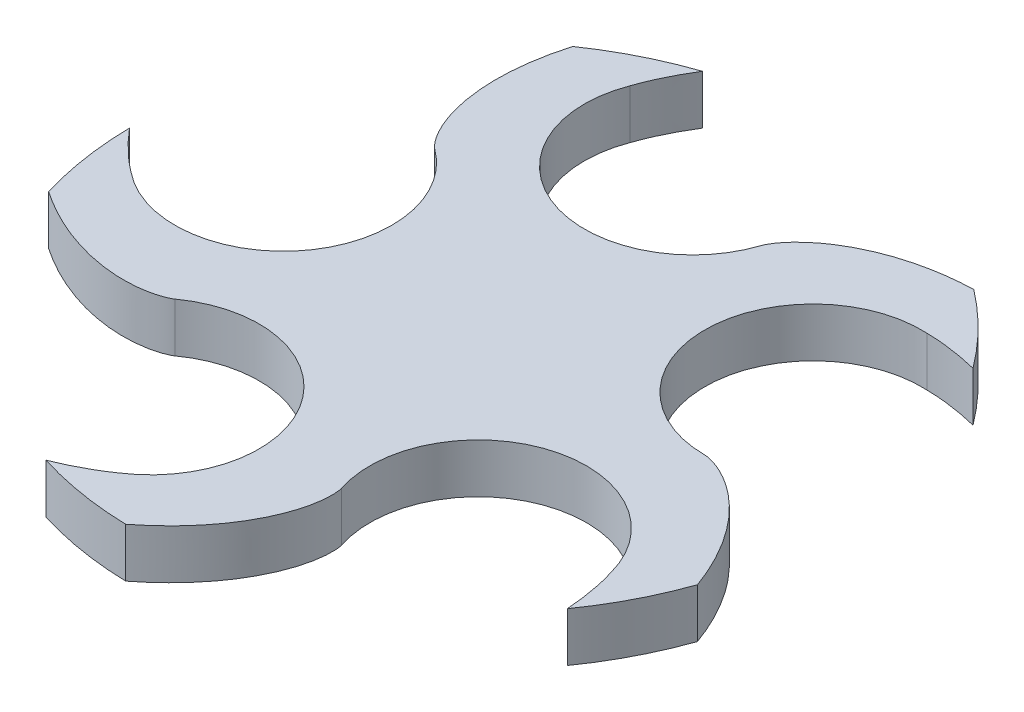
from build123d import *

# Parameters (mm, degrees)
SKETCH_1_R               = 71
EXTRUDE_1_DEPTH          = 5
SWEEP_START              = -5
SWEEP_1_DEPTH            = 10
SKETCH_3_W               = 22
SKETCH_3_H               = 10
PATTERN_CIRCULAR_1_COUNT = 5


# Read off the part's stored shape, not the designer's step: 切除-扫描1
with BuildPart() as part:
    # 草图1 → 凸台-拉伸1 (new, symmetric)
    with BuildSketch(Plane(origin=(0, 0, 0), x_dir=(1, 0, 0), z_dir=(0, 1, 0))):
        with Locations(Location((0, 0, 0), (0, 0, 270))):
            Circle(SKETCH_1_R)
    extrude(amount=EXTRUDE_1_DEPTH, both=True)

    # 切除-扫描1 outline → 切除-扫描1 (cut)
    with BuildSketch(Plane(origin=(0, 0, 0), x_dir=(1, 0, 0), z_dir=(0, 1, 0)).offset(SWEEP_START)):
        with BuildLine():
            Line((44.8999, 44), (44.8999, 0))
            add(Edge.make_bspline(
                [(44.8999, 0), (44.916561994, 0.000191347), (44.933259096, 0.000381998), (44.969446274, -0.000448692), (44.988908731, -0.001665871), (45.027841486, -0.00410628), (45.04726857, -0.005445338), (45.105435907, -0.010090978), (45.144104987, -0.01379923), (45.259805119, -0.026283625), (45.33654128, -0.03637541), (45.565945621, -0.070552579), (45.717932624, -0.098483603), (46.020333363, -0.161720525), (46.171094363, -0.197235401), (46.396888378, -0.255141946), (46.472031185, -0.275270724), (46.621872304, -0.316984405), (46.69663955, -0.338508995), (46.920092847, -0.405215815), (47.069540287, -0.452627037), (47.366049366, -0.552214559), (47.514123864, -0.604520722), (47.809119565, -0.713797573), (47.95617674, -0.770691592), (48.175586743, -0.859230018), (48.248622999, -0.889259555), (48.357750438, -0.934974229), (48.394110156, -0.950310128), (48.466649517, -0.981312724), (48.50251174, -0.996745919), (48.575497426, -1.028478937), (48.612552106, -1.044714784), (48.685855112, -1.077042599), (48.72243235, -1.093374379), (48.831899215, -1.142674788), (48.904640163, -1.175956007), (49.049463149, -1.24321203), (49.121491172, -1.277323431), (49.229061727, -1.328840559), (49.264815693, -1.346119986), (49.336111631, -1.380871104), (49.37169776, -1.398279431), (49.478249648, -1.451020625), (49.549127498, -1.486486891), (49.690429618, -1.558297415), (49.760823693, -1.594699072), (49.971666477, -1.704535079), (50.11121904, -1.779672727), (50.388028463, -1.931843655), (50.525106993, -2.009219245), (50.797819472, -2.16648661), (50.933339813, -2.24659507), (51.202877906, -2.409310011), (51.336931807, -2.491895295), (51.5033746, -2.59691805), (51.536635541, -2.617968989), (51.60305195, -2.660246506), (51.636193587, -2.681482176), (51.702418803, -2.724062169), (51.735506295, -2.745388547), (51.801529555, -2.788279138), (51.83448472, -2.809817106), (51.900031902, -2.852816994), (51.932632998, -2.874280696), (51.981438761, -2.90661199), (51.997683073, -2.917426998), (52.030190412, -2.939032245), (52.046433322, -2.949844151), (52.078838589, -2.971598736), (52.095058922, -2.982456937), (52.127474374, -3.004194102), (52.143632925, -3.01513569), (52.192142382, -3.047921881), (52.224480641, -3.069776937), (52.385754428, -3.179676238), (52.513960597, -3.268801627), (52.768949774, -3.449033479), (52.895695422, -3.540211535), (53.147512638, -3.724795094), (53.272658894, -3.818100974), (53.460287362, -3.960131365), (53.52323327, -4.008272903), (53.648722432, -4.105061503), (53.711286088, -4.153683755), (53.836083407, -4.251336901), (53.898254999, -4.300448776), (54.022164217, -4.399207025), (54.083912882, -4.44883848), (54.268777657, -4.598195997), (54.391045114, -4.698957412), (54.543098971, -4.825834507), (54.573406839, -4.851332597), (54.618923659, -4.889513481), (54.634052767, -4.902290051), (54.664278153, -4.9278862), (54.679442376, -4.940623418), (54.724736542, -4.979065015), (54.754890875, -5.004746387), (54.815109151, -5.056206991), (54.845200209, -5.081961863), (54.905004448, -5.133509762), (54.934771216, -5.159245039), (54.994256886, -5.210768228), (55.023888349, -5.236657655), (55.083179792, -5.288408226), (55.112781108, -5.314330282), (55.171833606, -5.366354219), (55.201310238, -5.392421962), (55.260222992, -5.444602796), (55.289591507, -5.470796804), (55.333666463, -5.51005387), (55.348278652, -5.523225195), (55.377587468, -5.54949182), (55.392262354, -5.562591307), (55.421466865, -5.588965017), (55.43612197, -5.602101482), (55.465334146, -5.62845874), (55.479874125, -5.641720818), (55.509084908, -5.66809153), (55.52362817, -5.681335336), (55.552714608, -5.707848674), (55.567310103, -5.721045115), (55.610929361, -5.760811955), (55.639944692, -5.787400551), (55.697867093, -5.840687942), (55.726788198, -5.867377848), (55.813453747, -5.947558979), (55.871007332, -6.001244533), (55.942715648, -6.068621357), (55.957076348, -6.082080519), (55.985757753, -6.109026642), (56.000010315, -6.122590693), (56.042920701, -6.16315426), (56.071490022, -6.1902122), (56.128485312, -6.244513001), (56.157007381, -6.271637737), (56.213794816, -6.326148138), (56.242162485, -6.353442863), (56.298671659, -6.407917253), (56.326709837, -6.435213939), (56.368832998, -6.476100375), (56.382869349, -6.489727999), (56.410870169, -6.517065387), (56.424883889, -6.530726173), (56.494827856, -6.599119938), (56.55062998, -6.654023151), (56.633967279, -6.736717431), (56.661706213, -6.764335918), (56.71714206, -6.819594086), (56.744727664, -6.847356775), (56.799960093, -6.90283554), (56.827526048, -6.930621805), (56.882569862, -6.986275886), (56.910033465, -7.014173717), (56.96493682, -7.069972508), (56.99225245, -7.098006339), (57.033272391, -7.14002298), (57.046950213, -7.154019348), (57.074224499, -7.182095728), (57.087868812, -7.196133807), (57.115123384, -7.224227777), (57.12871507, -7.238313767), (57.155930817, -7.266451991), (57.169500746, -7.280550962), (57.196642364, -7.308766844), (57.210228898, -7.32285132), (57.237292181, -7.351136269), (57.250877279, -7.365241872), (57.291527367, -7.40760017), (57.318481722, -7.43600565), (57.372430503, -7.492742058), (57.399347675, -7.521169802), (57.45307395, -7.578136116), (57.479942087, -7.606605358), (57.520143989, -7.649424035), (57.533547562, -7.663686596), (57.560272754, -7.692297979), (57.573654904, -7.70659108), (57.600281436, -7.735160615), (57.613538273, -7.749444187), (57.640082845, -7.777969338), (57.653287751, -7.792288996), (57.679803561, -7.820858055), (57.693079645, -7.835106852), (57.719465067, -7.863778494), (57.73266659, -7.878113874), (57.759060077, -7.906782014), (57.772268772, -7.921111922), (57.798659111, -7.949777643), (57.811750597, -7.964202006), (57.838062553, -7.992960162), (57.851237439, -8.007307398), (57.877483068, -8.036113156), (57.890624413, -8.050501916), (57.929935573, -8.093757497), (57.956096434, -8.122641882), (58.008327958, -8.180498515), (58.03447753, -8.209389407), (58.073456162, -8.252952245), (58.086468116, -8.267464726), (58.112508301, -8.296457783), (58.125489824, -8.310986208), (58.1643678, -8.354640205), (58.190306585, -8.383729817), (58.267833522, -8.47124281), (58.319355499, -8.5297374), (58.396453771, -8.61763532), (58.422046776, -8.647028534), (58.460467922, -8.691089601), (58.473262278, -8.705786064), (58.498755138, -8.735262087), (58.511497752, -8.750012089), (58.549824224, -8.794157107), (58.575206069, -8.823727238), (58.626030617, -8.882831002), (58.65137744, -8.912432615), (58.702055439, -8.97166088), (58.72735243, -9.001309536), (58.765202909, -9.045857089), (58.777782799, -9.060741358), (58.802981404, -9.090472319), (58.815516075, -9.105387132), (58.840891172, -9.135397978), (58.853700082, -9.150499952), (58.879142266, -9.180865527), (58.891934453, -9.195993137), (58.930168796, -9.241474713), (58.955494057, -9.271940141), (59.031675506, -9.363152892), (59.082140369, -9.424228963), (59.145194143, -9.500590382), (59.157780723, -9.515881055), (59.182861469, -9.54654024), (59.195426456, -9.56185403), (59.23315314, -9.607754399), (59.258102993, -9.638519321), (59.308131148, -9.699945899), (59.333035188, -9.730745247), (59.370446485, -9.776900915), (59.382893564, -9.792302964), (59.407731144, -9.823155658), (59.420160992, -9.838573673), (59.457447395, -9.884826202), (59.482220304, -9.915727903), (59.531613271, -9.977652121), (59.556260156, -10.00865379), (59.593300356, -10.055096719), (59.605620056, -10.070598305), (59.630121453, -10.101710732), (59.642375147, -10.117265774), (59.666957967, -10.148313611), (59.679234267, -10.163847731), (59.703654619, -10.195021599), (59.715921411, -10.210564656), (59.752606853, -10.257279206), (59.7769867, -10.288482188), (59.825725831, -10.350900371), (59.850092005, -10.382110322), (59.898544858, -10.444744049), (59.922755415, -10.476071537), (59.959000347, -10.523115109), (59.971081089, -10.538796552), (59.995266666, -10.570140179), (60.007263293, -10.585885987), (60.031302961, -10.617269957), (60.043332758, -10.6329198), (60.067219281, -10.664349527), (60.079250421, -10.679996979), (60.103155478, -10.711411932), (60.115099613, -10.727124634), (60.138998265, -10.758542993), (60.150893894, -10.77429231), (60.174741782, -10.805747459), (60.186625831, -10.821505382), (60.210384091, -10.853026768), (60.222281799, -10.868772996), (60.246047115, -10.900288394), (60.257881998, -10.916081907), (60.281572586, -10.947651639), (60.293459316, -10.963404479), (60.317110908, -10.995004908), (60.328861893, -11.010858151), (60.352511137, -11.042457064), (60.36423183, -11.058335019), (60.38777312, -11.090011804), (60.399564622, -11.105836038), (60.42305835, -11.137548267), (60.434819482, -11.153393307), (60.493555029, -11.232671167), (60.540169995, -11.296366321), (60.610074902, -11.391911935), (60.63325854, -11.423848552), (60.668076095, -11.471715578), (60.679703662, -11.487657055), (60.702830815, -11.519631777), (60.71435481, -11.535645537), (60.737526796, -11.567585257), (60.749032819, -11.58361624), (60.772070777, -11.615649714), (60.783642332, -11.631630627), (60.806658252, -11.663683402), (60.81812571, -11.679738548), (60.841063488, -11.711844586), (60.852591642, -11.727852767), (60.87556522, -11.759937269), (60.886968597, -11.776035621), (60.909863053, -11.808172803), (60.92122386, -11.824303279), (60.944109204, -11.856442415), (60.955534539, -11.872530959), (60.978244962, -11.904795388), (60.98964623, -11.92089508), (61.012382476, -11.953142411), (61.02373638, -11.969275232), (61.046496804, -12.001503399), (61.057840901, -12.017647839), (61.080437058, -12.049990393), (61.091808651, -12.066111055), (61.114392375, -12.09846503), (61.125717239, -12.114615191), (61.148253342, -12.146942608), (61.159458879, -12.16311287), (61.18194466, -12.195408826), (61.193112076, -12.211609184), (61.215564895, -12.243924241), (61.226805447, -12.260074491), (61.249169792, -12.292455187), (61.260323087, -12.308662404), (61.282660487, -12.341060273), (61.293753929, -12.357311459), (61.316059703, -12.389726231), (61.327277221, -12.405889708), (61.349528169, -12.438352641), (61.360533434, -12.454660687), (61.382722673, -12.487156393), (61.393811279, -12.503409972), (61.416002872, -12.535904738), (61.42708239, -12.552166187), (61.449172273, -12.584730955), (61.46023015, -12.601002122), (61.482354338, -12.633545347), (61.493315635, -12.649888217), (61.515321485, -12.682505104), (61.526355651, -12.69879724), (61.559300109, -12.747773709), (61.581304998, -12.780393757), (61.614074819, -12.829491181), (61.624977044, -12.84586579), (61.646865564, -12.87856551), (61.65778817, -12.894934865), (61.679509667, -12.927745341), (61.690504574, -12.944052027), (61.712287326, -12.976838684), (61.72306549, -12.993290075), (61.755722054, -13.042459267), (61.777297132, -13.075373623), (61.809812238, -13.124626607), (61.820650626, -13.141056851), (61.842145217, -13.174015288), (61.852985937, -13.190431167), (61.874526135, -13.223366833), (61.885230303, -13.2398764), (61.906726456, -13.272830991), (61.917505277, -13.289294915), (61.938932288, -13.322301036), (61.949648234, -13.338798818), (61.971114692, -13.371779352), (61.981771181, -13.388326149), (62.003080708, -13.421402352), (62.013804087, -13.437895556), (62.035163167, -13.470952212), (62.045704101, -13.487564483), (62.067082623, -13.520595406), (62.077712166, -13.537165885), (62.098902197, -13.570317944), (62.109549295, -13.586865332), (62.14134543, -13.636600561), (62.162501452, -13.669779043), (62.204648234, -13.736141736), (62.225687091, -13.76928539), (62.25710438, -13.819094307), (62.267600253, -13.83567879), (62.288501626, -13.868919314), (62.298918896, -13.88554983), (62.330309755, -13.935377112), (62.351152782, -13.968653235), (62.392699964, -14.035276412), (62.413484346, -14.068589824), (62.454891428, -14.135301958), (62.475558498, -14.168687284), (62.506502387, -14.218794852), (62.516813127, -14.235496323), (62.537460024, -14.268894412), (62.547684921, -14.285660827), (62.578454189, -14.335865343), (62.599048621, -14.369307841), (62.629655626, -14.419621818), (62.639913849, -14.436355851), (62.66033385, -14.469899307), (62.670484344, -14.486705371), (62.690822276, -14.520287115), (62.701036752, -14.537047415), (62.721430085, -14.570607741), (62.73151317, -14.587457943), (62.761953208, -14.637868175), (62.78221759, -14.671517529), (62.842699189, -14.772593066), (62.88310454, -14.839945961), (62.943109649, -14.941326787), (62.963083683, -14.97512716), (62.993089551, -15.02582247), (63.003037549, -15.042760741), (63.022859959, -15.076658463), (63.032825956, -15.093565743), (63.052756865, -15.12740734), (63.062629722, -15.144396476), (63.082389311, -15.178317605), (63.092353919, -15.195244401), (63.112091824, -15.22919897), (63.121962762, -15.246167168), (63.141731065, -15.280102061), (63.151574529, -15.29710011), (63.171203621, -15.331062086), (63.181037238, -15.348003084), (63.200655162, -15.38193652), (63.21036167, -15.398945687), (63.2300594, -15.432814426), (63.239834067, -15.449821098), (63.259260916, -15.483851611), (63.26902211, -15.500826109), (63.288561729, -15.534805615), (63.298258229, -15.551829643), (63.3177243, -15.585844226), (63.327396226, -15.602892445), (63.346761566, -15.636958214), (63.356442869, -15.65399655), (63.375822273, -15.688052299), (63.385501503, -15.70510772), (63.39995263, -15.730692317), (63.404797086, -15.739197102), (63.414500997, -15.756225209), (63.419333007, -15.764766118), (63.433685384, -15.79043038), (63.443319014, -15.807461483), (63.472212162, -15.858691232), (63.491375863, -15.892857111), (63.520105026, -15.944156499), (63.529639598, -15.961274437), (63.548781718, -15.995472926), (63.558263937, -16.012651585), (63.577264972, -16.046898172), (63.586879323, -16.063992106), (63.601132271, -16.089700366), (63.60589234, -16.098258301), (63.615416602, -16.115390457), (63.620162141, -16.12397632), (63.634313383, -16.149748431), (63.643840353, -16.166843663), (63.662821882, -16.201166696), (63.672192465, -16.218382646), (63.691060743, -16.252718537), (63.700583183, -16.269863298), (63.719368247, -16.304272816), (63.728783148, -16.321444524), (63.74766662, -16.355797533), (63.757026191, -16.373041389), (63.775742211, -16.407461754), (63.785142564, -16.424675996), (63.799170439, -16.450504471), (63.803864157, -16.459099039), (63.813255487, -16.476306727), (63.817936065, -16.484929097), (63.831899362, -16.510810061), (63.841235361, -16.528026091), (63.869224479, -16.57975449), (63.887810973, -16.614239893), (63.915696503, -16.666044799), (63.924838699, -16.683376928), (63.943436156, -16.7178687), (63.952663239, -16.73519895), (63.971138113, -16.76974523), (63.980375626, -16.787078652), (63.994138239, -16.813036584), (63.998768279, -16.821660327), (64.008031332, -16.838942606), (64.012637658, -16.847611174), (64.021804411, -16.864939985), (64.026390723, -16.873587983), (64.035607845, -16.890886823), (64.040216065, -16.899553203), (64.053915931, -16.925587449), (64.063109591, -16.942862521), (64.081474544, -16.97750755), (64.090533646, -16.994828641), (64.10877874, -17.029456647), (64.117874384, -17.046795829), (64.145081027, -17.098815891), (64.163286002, -17.133457806), (64.199573244, -17.202831498), (64.217705082, -17.237515079), (64.253648932, -17.307097959), (64.271682064, -17.341799469), (64.298578339, -17.394025136), (64.3074878, -17.41143556), (64.325421992, -17.446231861), (64.334346148, -17.463655767), (64.361167362, -17.515885917), (64.37892513, -17.550800175), (64.405629275, -17.603063727), (64.414580475, -17.620493853), (64.432254415, -17.655433511), (64.441085488, -17.672886991), (64.458825424, -17.707777647), (64.467710786, -17.725227811), (64.485333788, -17.760204947), (64.494128853, -17.777668524), (64.520604854, -17.830102663), (64.53818874, -17.865078217), (64.564460045, -17.917606235), (64.573184145, -17.93512589), (64.590741369, -17.970100135), (64.599514379, -17.98763474), (64.616895476, -18.022715607), (64.625615243, -18.04021419), (64.638722324, -18.066508257), (64.643067034, -18.075297461), (64.651716711, -18.09286017), (64.656041872, -18.10162453), (64.677809424, -18.145431194), (64.695182891, -18.180576793), (64.7210048, -18.233309923), (64.729672218, -18.250829572), (64.747007371, -18.285977449), (64.755478932, -18.303617843), (64.772770492, -18.338726778), (64.781354516, -18.356367083), (64.798462028, -18.391572611), (64.80705493, -18.409154674), (64.824236076, -18.444344714), (64.832787479, -18.461981453), (64.849813393, -18.497230662), (64.858384009, -18.514832722), (64.883938577, -18.567725956), (64.900969555, -18.602988906), (64.951718319, -18.708833399), (64.985562067, -18.779345877), (65.027445556, -18.867718526), (65.035788339, -18.885409692), (65.052533231, -18.920729346), (65.060962239, -18.938403234), (65.077581763, -18.973822056), (65.085880576, -18.991507327), (65.102571881, -19.026875457), (65.110866531, -19.04459602), (65.127551089, -19.079946297), (65.135870439, -19.097698229), (65.152392293, -19.133121185), (65.160725651, -19.150813599), (65.177255804, -19.186289798), (65.185438139, -19.20404174), (65.201936319, -19.239501109), (65.210139702, -19.257264799), (65.234859842, -19.310447592), (65.251292627, -19.345997928), (65.283981025, -19.417034244), (65.300405663, -19.45256646), (65.332887681, -19.52373761), (65.349221331, -19.559270924), (65.373480593, -19.612720276), (65.381541887, -19.630520479), (65.397745421, -19.666125566), (65.405821308, -19.683960586), (65.429947683, -19.73743583), (65.44617327, -19.772991897), (65.470214377, -19.826598711), (65.478133976, -19.844462721), (65.494163958, -19.880110526), (65.502219035, -19.897993686), (65.514119614, -19.924791827), (65.518109307, -19.933692391), (65.52612462, -19.951539797), (65.530118424, -19.960499318), (65.541990891, -19.987337602), (65.550001086, -20.00512368), (65.565974771, -20.040877153), (65.573805714, -20.05884051), (65.589607909, -20.094546392), (65.597617762, -20.112434028), (65.613381833, -20.14825331), (65.621248864, -20.166127834), (65.637064297, -20.201930939), (65.64485117, -20.219861473), (65.656716869, -20.246685807), (65.660677992, -20.255654106), (65.668512569, -20.27359679), (65.672405477, -20.282554078), (65.684176255, -20.309405106), (65.691987022, -20.327406178), (65.707608872, -20.363184417), (65.715486562, -20.381143469), (65.727125331, -20.408038366), (65.731028173, -20.416984636), (65.738831447, -20.434923905), (65.742708689, -20.443918438), (65.754306102, -20.470841295), (65.762149941, -20.488731207), (65.777657122, -20.524657448), (65.785350941, -20.542622759), (65.808554006, -20.596462759), (65.82401724, -20.632401822), (65.8471039, -20.686318883), (65.854798552, -20.704273507), (65.870198847, -20.740240724), (65.87778082, -20.758248959), (65.893182119, -20.794171151), (65.900842716, -20.812214725), (65.916005489, -20.84825673), (65.923648549, -20.866202497), (65.938914019, -20.902253647), (65.946463089, -20.920270794), (65.961653461, -20.956296357), (65.969240096, -20.974325192), (65.984417487, -21.010338107), (65.992085058, -21.028338602), (66.007170086, -21.064441818), (66.014688721, -21.082463005), (66.029789945, -21.118532888), (66.037301839, -21.1366114), (66.052249702, -21.172738482), (66.059765022, -21.190743928), (66.074853843, -21.226841194), (66.082303899, -21.244968111), (66.097162507, -21.281087042), (66.104754912, -21.299112231), (66.119624346, -21.33530556), (66.127039545, -21.353361222), (66.141945465, -21.389519118), (66.149277722, -21.407672511), (66.164144653, -21.443762104), (66.171622752, -21.461901022), (66.186356451, -21.498100017), (66.193763399, -21.516186638), (66.215912255, -21.570514468), (66.230503237, -21.606787769), (66.252568302, -21.661114211), (66.259931719, -21.67924386), (66.274533389, -21.715526421), (66.281867333, -21.733610339), (66.303831242, -21.788055241), (66.318314876, -21.824335868), (66.347289648, -21.897002489), (66.361701125, -21.933317852), (66.383484094, -21.987762219), (66.390655672, -22.005994883), (66.405021278, -22.042324705), (66.41224798, -22.060488976), (66.426552937, -22.096913359), (66.43370951, -22.115052542), (66.448108793, -22.151462096), (66.455166528, -22.169690482), (66.469465559, -22.206061187), (66.476654399, -22.224294743), (66.4907655, -22.260753585), (66.497958691, -22.278896834), (66.512162983, -22.315364946), (66.519238749, -22.333564478), (66.533411082, -22.370020255), (66.540453628, -22.388271761), (66.561554977, -22.442980764), (66.575667221, -22.479470827), (66.596705953, -22.534189991), (66.603785155, -22.552422852), (66.617751529, -22.58896072), (66.624719444, -22.607200372), (66.638716394, -22.643716456), (66.645604581, -22.66203646), (66.659544235, -22.698512808), (66.666534326, -22.716822832), (66.680367786, -22.753375469), (66.687332224, -22.771623595), (66.7011696, -22.808237904), (66.708003776, -22.826503036), (66.728829047, -22.881351867), (66.74255065, -22.917973148), (66.763058943, -22.97291522), (66.769970311, -22.991177787), (66.783642379, -23.027840365), (66.790483729, -23.046120417), (66.80405512, -23.082840076), (66.81083606, -23.101083902), (66.824520252, -23.137768532), (66.831218121, -23.156125548), (66.851540487, -23.211099881), (66.865151991, -23.247757682), (66.892095467, -23.321176892), (66.905573723, -23.357816778), (66.925633554, -23.412986717), (66.932235235, -23.431358839), (66.94565308, -23.468029179), (66.952361578, -23.48645524), (66.965267838, -23.522336064), (66.971645411, -23.539801109), (66.978007861, -23.557301692)],
                knots=[0, 0, 0, 0, 0.001342085, 0.001342085, 0.002918488, 0.002918488, 0.004494891, 0.004494891, 0.007647696, 0.007647696, 0.013953308, 0.013953308, 0.02656453, 0.02656453, 0.039175752, 0.039175752, 0.045481363, 0.045481363, 0.051786974, 0.051786974, 0.064328355, 0.064328355, 0.076869736, 0.076869736, 0.089411117, 0.089411117, 0.095681807, 0.095681807, 0.098817152, 0.098817152, 0.101952498, 0.101952498, 0.105140621, 0.105140621, 0.108328744, 0.108328744, 0.114704991, 0.114704991, 0.121081237, 0.121081237, 0.12426936, 0.12426936, 0.127457484, 0.127457484, 0.13383373, 0.13383373, 0.140209977, 0.140209977, 0.15296247, 0.15296247, 0.165627501, 0.165627501, 0.178292533, 0.178292533, 0.190957565, 0.190957565, 0.194123823, 0.194123823, 0.197290081, 0.197290081, 0.200456339, 0.200456339, 0.203622596, 0.203622596, 0.206761595, 0.206761595, 0.208331094, 0.208331094, 0.209900594, 0.209900594, 0.211470093, 0.211470093, 0.213039592, 0.213039592, 0.216178591, 0.216178591, 0.228734585, 0.228734585, 0.24129058, 0.24129058, 0.253846574, 0.253846574, 0.260222122, 0.260222122, 0.266597669, 0.266597669, 0.272973216, 0.272973216, 0.279348764, 0.279348764, 0.292099858, 0.292099858, 0.295287632, 0.295287632, 0.296881519, 0.296881519, 0.298475406, 0.298475406, 0.301663179, 0.301663179, 0.304850953, 0.304850953, 0.30801797, 0.30801797, 0.311184986, 0.311184986, 0.314352003, 0.314352003, 0.317519019, 0.317519019, 0.320686036, 0.320686036, 0.322269544, 0.322269544, 0.323853053, 0.323853053, 0.325436561, 0.325436561, 0.327020069, 0.327020069, 0.328603577, 0.328603577, 0.330187086, 0.330187086, 0.333354102, 0.333354102, 0.336521119, 0.336521119, 0.342855152, 0.342855152, 0.34443866, 0.34443866, 0.346022169, 0.346022169, 0.349189185, 0.349189185, 0.352356202, 0.352356202, 0.355523218, 0.355523218, 0.358671699, 0.358671699, 0.360245939, 0.360245939, 0.361820179, 0.361820179, 0.36811714, 0.36811714, 0.37126562, 0.37126562, 0.374414101, 0.374414101, 0.377562581, 0.377562581, 0.380711062, 0.380711062, 0.383859542, 0.383859542, 0.385433782, 0.385433782, 0.387008022, 0.387008022, 0.388582263, 0.388582263, 0.390156503, 0.390156503, 0.391730743, 0.391730743, 0.393304983, 0.393304983, 0.396453464, 0.396453464, 0.399601944, 0.399601944, 0.402750424, 0.402750424, 0.404324665, 0.404324665, 0.405898905, 0.405898905, 0.407465635, 0.407465635, 0.409032366, 0.409032366, 0.410599097, 0.410599097, 0.412165827, 0.412165827, 0.413732558, 0.413732558, 0.415299289, 0.415299289, 0.41686602, 0.41686602, 0.41843275, 0.41843275, 0.421566212, 0.421566212, 0.424699673, 0.424699673, 0.426266404, 0.426266404, 0.427833134, 0.427833134, 0.430966596, 0.430966596, 0.437233518, 0.437233518, 0.44036698, 0.44036698, 0.44193371, 0.44193371, 0.443500441, 0.443500441, 0.446633902, 0.446633902, 0.449767364, 0.449767364, 0.452900825, 0.452900825, 0.454467556, 0.454467556, 0.456034286, 0.456034286, 0.45762682, 0.45762682, 0.459219353, 0.459219353, 0.462404421, 0.462404421, 0.468774555, 0.468774555, 0.470367088, 0.470367088, 0.471959622, 0.471959622, 0.475144689, 0.475144689, 0.478329756, 0.478329756, 0.479922289, 0.479922289, 0.481514823, 0.481514823, 0.48469989, 0.48469989, 0.487884957, 0.487884957, 0.489477491, 0.489477491, 0.491070024, 0.491070024, 0.492662558, 0.492662558, 0.494255091, 0.494255091, 0.497440158, 0.497440158, 0.500625225, 0.500625225, 0.503810292, 0.503810292, 0.505402826, 0.505402826, 0.506995359, 0.506995359, 0.508583428, 0.508583428, 0.510171497, 0.510171497, 0.511759566, 0.511759566, 0.513347634, 0.513347634, 0.514935703, 0.514935703, 0.516523772, 0.516523772, 0.51811184, 0.51811184, 0.519699909, 0.519699909, 0.521287978, 0.521287978, 0.522876046, 0.522876046, 0.524464115, 0.524464115, 0.526052184, 0.526052184, 0.532404458, 0.532404458, 0.535580596, 0.535580596, 0.537168665, 0.537168665, 0.538756733, 0.538756733, 0.540344802, 0.540344802, 0.541932871, 0.541932871, 0.543520939, 0.543520939, 0.545109008, 0.545109008, 0.546697077, 0.546697077, 0.548285145, 0.548285145, 0.549873214, 0.549873214, 0.551461283, 0.551461283, 0.553049351, 0.553049351, 0.55463742, 0.55463742, 0.556225489, 0.556225489, 0.557813557, 0.557813557, 0.559397485, 0.559397485, 0.560981413, 0.560981413, 0.562565341, 0.562565341, 0.564149269, 0.564149269, 0.565733197, 0.565733197, 0.567317125, 0.567317125, 0.568901052, 0.568901052, 0.57048498, 0.57048498, 0.572068908, 0.572068908, 0.573652836, 0.573652836, 0.575236764, 0.575236764, 0.576820692, 0.576820692, 0.579988547, 0.579988547, 0.581572475, 0.581572475, 0.583156403, 0.583156403, 0.584740331, 0.584740331, 0.586324259, 0.586324259, 0.589492115, 0.589492115, 0.591076042, 0.591076042, 0.59265997, 0.59265997, 0.594243898, 0.594243898, 0.595827826, 0.595827826, 0.597411754, 0.597411754, 0.598995682, 0.598995682, 0.60057961, 0.60057961, 0.602163537, 0.602163537, 0.603747465, 0.603747465, 0.605331393, 0.605331393, 0.608499249, 0.608499249, 0.61165955, 0.61165955, 0.613239701, 0.613239701, 0.614819852, 0.614819852, 0.617980153, 0.617980153, 0.621140454, 0.621140454, 0.624300756, 0.624300756, 0.625880906, 0.625880906, 0.627461057, 0.627461057, 0.630621358, 0.630621358, 0.632201509, 0.632201509, 0.63378166, 0.63378166, 0.63536181, 0.63536181, 0.636941961, 0.636941961, 0.640102262, 0.640102262, 0.646422865, 0.646422865, 0.649583166, 0.649583166, 0.651163317, 0.651163317, 0.652743468, 0.652743468, 0.654323618, 0.654323618, 0.655903769, 0.655903769, 0.65748392, 0.65748392, 0.65906407, 0.65906407, 0.660640707, 0.660640707, 0.662217344, 0.662217344, 0.663793981, 0.663793981, 0.665370617, 0.665370617, 0.666947254, 0.666947254, 0.668523891, 0.668523891, 0.670100528, 0.670100528, 0.671677165, 0.671677165, 0.672465483, 0.672465483, 0.673253801, 0.673253801, 0.674830438, 0.674830438, 0.677983712, 0.677983712, 0.679560349, 0.679560349, 0.681136985, 0.681136985, 0.682713622, 0.682713622, 0.683501941, 0.683501941, 0.684290259, 0.684290259, 0.685866896, 0.685866896, 0.687443533, 0.687443533, 0.689020169, 0.689020169, 0.690596806, 0.690596806, 0.692173443, 0.692173443, 0.69375008, 0.69375008, 0.694538398, 0.694538398, 0.695326717, 0.695326717, 0.696903353, 0.696903353, 0.700056627, 0.700056627, 0.701633264, 0.701633264, 0.703209901, 0.703209901, 0.704786537, 0.704786537, 0.705574856, 0.705574856, 0.706363174, 0.706363174, 0.707151493, 0.707151493, 0.707939811, 0.707939811, 0.709516448, 0.709516448, 0.711090363, 0.711090363, 0.712664278, 0.712664278, 0.715812108, 0.715812108, 0.718959939, 0.718959939, 0.722107769, 0.722107769, 0.723681684, 0.723681684, 0.725255599, 0.725255599, 0.72840343, 0.72840343, 0.729977345, 0.729977345, 0.73155126, 0.73155126, 0.733125175, 0.733125175, 0.73469909, 0.73469909, 0.73784692, 0.73784692, 0.739420836, 0.739420836, 0.740994751, 0.740994751, 0.742568666, 0.742568666, 0.743355624, 0.743355624, 0.744142581, 0.744142581, 0.747290411, 0.747290411, 0.748864327, 0.748864327, 0.750438242, 0.750438242, 0.752012157, 0.752012157, 0.753586072, 0.753586072, 0.755159987, 0.755159987, 0.756733902, 0.756733902, 0.759881733, 0.759881733, 0.766169478, 0.766169478, 0.767741414, 0.767741414, 0.769313351, 0.769313351, 0.770885287, 0.770885287, 0.772457223, 0.772457223, 0.77402916, 0.77402916, 0.775601096, 0.775601096, 0.777173033, 0.777173033, 0.778744969, 0.778744969, 0.781888842, 0.781888842, 0.785032714, 0.785032714, 0.788176587, 0.788176587, 0.789748523, 0.789748523, 0.79132046, 0.79132046, 0.794464332, 0.794464332, 0.796036269, 0.796036269, 0.797608205, 0.797608205, 0.798394173, 0.798394173, 0.799180142, 0.799180142, 0.800752078, 0.800752078, 0.802324014, 0.802324014, 0.803895951, 0.803895951, 0.805467887, 0.805467887, 0.807039823, 0.807039823, 0.807825791, 0.807825791, 0.80861176, 0.80861176, 0.810183696, 0.810183696, 0.811754806, 0.811754806, 0.812540361, 0.812540361, 0.813325916, 0.813325916, 0.814897026, 0.814897026, 0.816468137, 0.816468137, 0.819610357, 0.819610357, 0.821181467, 0.821181467, 0.822752577, 0.822752577, 0.824323687, 0.824323687, 0.825894798, 0.825894798, 0.827465908, 0.827465908, 0.829037018, 0.829037018, 0.830608128, 0.830608128, 0.832179238, 0.832179238, 0.833750348, 0.833750348, 0.835321459, 0.835321459, 0.836892569, 0.836892569, 0.838463679, 0.838463679, 0.840034789, 0.840034789, 0.841605899, 0.841605899, 0.843177009, 0.843177009, 0.84474812, 0.84474812, 0.84789034, 0.84789034, 0.84946145, 0.84946145, 0.85103256, 0.85103256, 0.854174781, 0.854174781, 0.857317001, 0.857317001, 0.858888111, 0.858888111, 0.860459221, 0.860459221, 0.862030533, 0.862030533, 0.863601844, 0.863601844, 0.865173156, 0.865173156, 0.866744468, 0.866744468, 0.868315779, 0.868315779, 0.869887091, 0.869887091, 0.873029714, 0.873029714, 0.874601026, 0.874601026, 0.876172337, 0.876172337, 0.877743649, 0.877743649, 0.879314961, 0.879314961, 0.880886272, 0.880886272, 0.882457584, 0.882457584, 0.885600207, 0.885600207, 0.887171519, 0.887171519, 0.88874283, 0.88874283, 0.890314142, 0.890314142, 0.891885454, 0.891885454, 0.895028077, 0.895028077, 0.8981707, 0.8981707, 0.899742012, 0.899742012, 0.901313323, 0.901313323, 0.902809963, 0.902809963, 0.902809963, 0.902809963], degree=3))
            ThreePointArc((66.978007861, -23.557301692), (70.186319632, 10.718233836), (56.894294079, 42.473983817))
            add(Edge.make_bspline(
                [(44.8999, 44), (46.11133384, 43.970849374), (48.534201519, 43.912548121), (52.552189373, 43.425904608), (55.275682333, 42.87626476), (56.894294079, 42.473983817)],
                knots=[0, 0, 0, 0, 0.03125, 0.0625, 0.112522484, 0.112522484, 0.112522484, 0.112522484], degree=3))
        make_face()
    sweep_1 = extrude(amount=SWEEP_1_DEPTH, mode=Mode.SUBTRACT)

    # 草图3 → 切除-旋转1 (revolve, cut)
    with BuildSketch(Plane(origin=(44.8999, 0, 0), x_dir=(0, 0, -1), z_dir=(1, 0, 0))):
        with Locations((11, 0)):
            Rectangle(SKETCH_3_W, SKETCH_3_H)
    cut_revolve_1 = revolve(axis=Axis((44.8999, -5, -22), (0, 1, 0)), mode=Mode.SUBTRACT)

    # 阵列(圆周)1: 切除-扫描1, 切除-旋转1 ×5 about axis
    pattern_circular_1_axis = Axis((0, 5, 0), (0, -1, 0))
    add([sweep_1.rotate(pattern_circular_1_axis, i * 360 / PATTERN_CIRCULAR_1_COUNT) for i in range(1, PATTERN_CIRCULAR_1_COUNT)], mode=Mode.SUBTRACT)
    add([cut_revolve_1.rotate(pattern_circular_1_axis, i * 360 / PATTERN_CIRCULAR_1_COUNT) for i in range(1, PATTERN_CIRCULAR_1_COUNT)], mode=Mode.SUBTRACT)


solid = part.part
